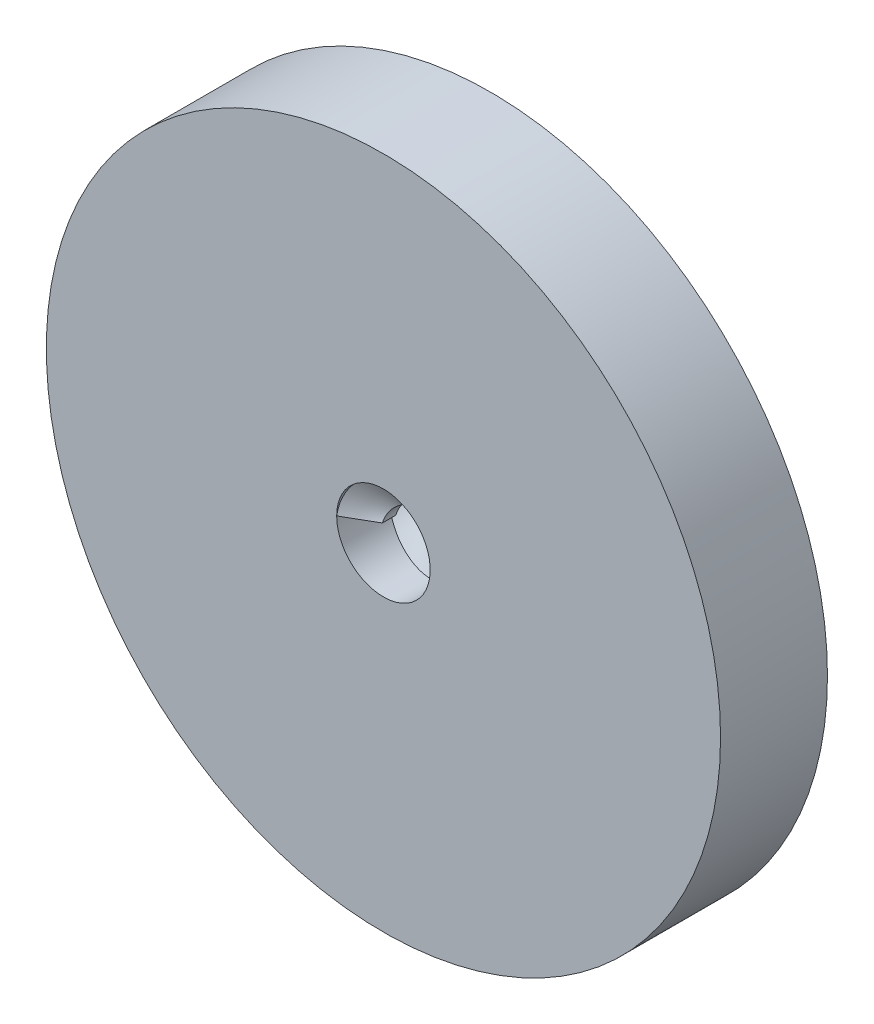
from build123d import *
from build123d.topology import SkipClean

# Parameters (mm, degrees)
CROQUIS1_R                 = 25.225
SALIENTE_EXTRUIR1_DEPTH    = 8
CROQUIS8_R                 = 3.5
CORTAR_EXTRUIR1_DEPTH      = 8
ROSCA1_PITCH               = 4
CORTAR_EXTRUIR2_DEPTH      = 37.559595635
CORTAR_EXTRUIR2_DEPTH_BACK = 37.559595635
CROQUIS11_W                = 9.138603142
CROQUIS11_H                = 6.021536875


with BuildPart() as part:
    # Croquis1 → Saliente-Extruir1 (new body)
    with BuildSketch(Plane.XY):
        Circle(CROQUIS1_R)
    extrude(amount=SALIENTE_EXTRUIR1_DEPTH)

    # Croquis8 → Cortar-Extruir1 (cut)
    with BuildSketch(Plane.XY.offset(8)):
        Circle(CROQUIS8_R)
    extrude(amount=-CORTAR_EXTRUIR1_DEPTH, mode=Mode.SUBTRACT)

    # Rosca1: the profile of Perfil de rosca2 profile screwed along a right-hand helix of 2 turns, 12 arcs to a turn; built about Z, then put on its axis
    with SkipClean():  # the faces are left unmerged after this step: merging them gives an invalid solid
        rosca1_z = Axis((0, 0, 0), (0, 0, 1))
        rosca1_corners = [(3.5003, 0, -0.000173205), (3.5003, 0, 3.500173194), (1.3349365, 0, 2.249999995), (1.3349365, 0, 1.249999995)]
        with BuildLine(mode=Mode.PRIVATE) as rosca1_profile:
            Line(rosca1_corners[0], rosca1_corners[1])
            Line(rosca1_corners[1], rosca1_corners[2])
            Line(rosca1_corners[2], rosca1_corners[3])
            Line(rosca1_corners[3], rosca1_corners[0])
        rosca1_cap = Face(rosca1_profile.wire())
        rosca1_turn_angles = [0, 15, 30, 45, 60, 75, 90, 105, 120, 135, 150, 165, 180, 195, 210, 225, 240, 255, 270, 285, 300, 315, 330, 345, 360]
        rosca1_turn_weights = [1, 0.9659258262890683, 1, 0.9659258262890683, 1, 0.9659258262890683, 1, 0.9659258262890683, 1, 0.9659258262890683, 1, 0.9659258262890683, 1, 0.9659258262890683, 1, 0.9659258262890683, 1, 0.9659258262890683, 1, 0.9659258262890683, 1, 0.9659258262890683, 1, 0.9659258262890683, 1]
        rosca1_turn_rails = [Edge.make_bspline([Vector(p[0], p[1], 0).rotate(rosca1_z, rosca1_turn_angles[k]) / rosca1_turn_weights[k] + Vector(0, 0, p[2] + ROSCA1_PITCH * rosca1_turn_angles[k] / 360) for k in range(25)], [0, 0, 0, 1, 1, 2, 2, 3, 3, 4, 4, 5, 5, 6, 6, 7, 7, 8, 8, 9, 9, 10, 10, 11, 11, 12, 12, 12], 2, rosca1_turn_weights) for p in rosca1_corners]
        rosca1_turn_sides = [Face.make_surface_from_curves(rosca1_turn_rails[p[0]], rosca1_turn_rails[p[1]]) for p in [(0, 1), (1, 2), (2, 3), (3, 0)]]
        rosca1 = Plane(origin=(0, 0, 8), x_dir=(-1, 0, 0), z_dir=(0, 0, -1)) * Solid(Shell([*[p.moved(Location((0, 0, ROSCA1_PITCH * i))) for i in range(2) for p in rosca1_turn_sides], rosca1_cap, rosca1_cap.rotate(rosca1_z, 720).moved(Location((0, 0, ROSCA1_PITCH * 720 / 360)))]))
        add(rosca1)

    # Croquis11 → Cortar-Extruir2 (cut, two sides: drawn at the far end of the back side and taken through both)
    with SkipClean():  # the faces are left unmerged after this step: merging them gives an invalid solid
        with BuildSketch(Plane(origin=(0, 0, 0), x_dir=(1, 0, 0), z_dir=(0, 1, 0)).offset(-CORTAR_EXTRUIR2_DEPTH_BACK)):
            with Locations((0.536755305, 3.010768438)):
                Rectangle(CROQUIS11_W, CROQUIS11_H)
        extrude(amount=CORTAR_EXTRUIR2_DEPTH + CORTAR_EXTRUIR2_DEPTH_BACK, mode=Mode.SUBTRACT)


solid = part.part
